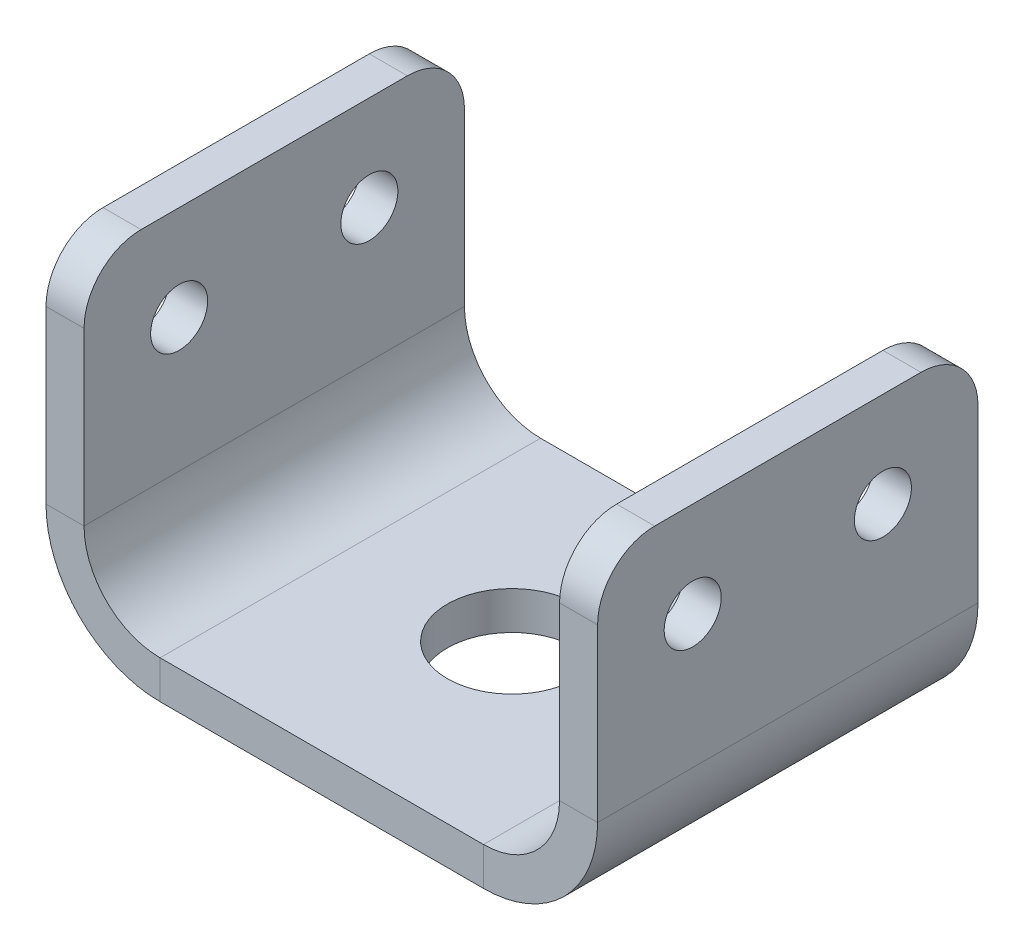
from build123d import *

# Parameters (mm, degrees)
SKETCH1_W            = 20
SKETCH1_H            = 6
BOSS_EXTRUDE1_DEPTH  = 14.5
SKETCH2_W            = 3
SKETCH2_H            = 20
BOSS_EXTRUDE2_DEPTH  = 12
SKETCH7_R            = 1.5
CUT_EXTRUDE1_DEPTH   = 33.939338184
SKETCH8_R            = 3.4
CUT_EXTRUDE2_DEPTH   = 26.184320519
FILLET1_R            = 3
CONVERT_SOLID3_START = -10
CONVERT_SOLID3_DEPTH = 20


# Read off the part's stored shape, not the designer's step: Convert-Solid3
with BuildPart() as part:
    # Sketch1 → Boss-Extrude1 (new, symmetric)
    with BuildSketch(Plane(origin=(0, 0, 0), x_dir=(0, 0, -1), z_dir=(1, 0, 0))):
        with Locations((0, -3)):
            Rectangle(SKETCH1_W, SKETCH1_H)
    extrude(amount=BOSS_EXTRUDE1_DEPTH, both=True)

    # Sketch2 → Boss-Extrude2 (add)
    with BuildSketch(Plane(origin=(0, 0, 0), x_dir=(1, 0, 0), z_dir=(0, 1, 0))):
        with Locations((13, 0)):
            Rectangle(SKETCH2_W, SKETCH2_H)
        with Locations((-13, 0)):
            Rectangle(SKETCH2_W, SKETCH2_H)
    extrude(amount=BOSS_EXTRUDE2_DEPTH)

    # Sketch7 → Cut-Extrude1 (cut, through all)
    with BuildSketch(Plane.ZY.offset(14.5)):
        with Locations((-5, 7)):
            Circle(SKETCH7_R)
        with Locations((5, 7)):
            Circle(SKETCH7_R)
    extrude(amount=-CUT_EXTRUDE1_DEPTH, mode=Mode.SUBTRACT)

    # Sketch8 → Cut-Extrude2 (cut, through all)
    with BuildSketch(Plane.XZ.offset(6)):
        with Locations(Location((0, 0, 0), (0, 0, 270))):
            Circle(SKETCH8_R)
    extrude(amount=-CUT_EXTRUDE2_DEPTH, mode=Mode.SUBTRACT)

    # Fillet1
    fillet1_edges = [part.edges().sort_by_distance(p)[0] for p in [
        (-13, 12, 10),
        (-13, 12, -10),
        (13, 12, -10),
        (13, 12, 10),
    ]]
    fillet(fillet1_edges, radius=FILLET1_R)

    # Convert-Solid3 outline → Convert-Solid3 (cut)
    with BuildSketch(Plane.XY.offset(CONVERT_SOLID3_START)):
        with BuildLine():
            Line((14.5, -6), (14.5, 0))
            ThreePointArc((14.5, 0), (12.742640687, -4.242640687), (8.5, -6))
            Line((8.5, -6), (14.5, -6))
        make_face()
        with BuildLine():
            Line((-14.5, -6), (-8.5, -6))
            ThreePointArc((-8.5, -6), (-12.742640687, -4.242640687), (-14.5, 0))
            Line((-14.5, 0), (-14.5, -6))
        make_face()
        with BuildLine():
            Line((12.5, 0), (12.5, 12))
            Line((12.5, 12), (11.5, 12))
            Line((11.5, 12), (11.5, 0))
            Line((11.5, 0), (-11.5, 0))
            Line((-11.5, 0), (-11.5, 12))
            Line((-11.5, 12), (-12.5, 12))
            Line((-12.5, 12), (-12.5, 0))
            ThreePointArc((-12.5, 0), (-11.328427125, -2.828427125), (-8.5, -4))
            Line((-8.5, -4), (8.5, -4))
            ThreePointArc((8.5, -4), (11.328427125, -2.828427125), (12.5, 0))
        make_face()
    extrude(amount=CONVERT_SOLID3_DEPTH, mode=Mode.SUBTRACT)


solid = part.part
